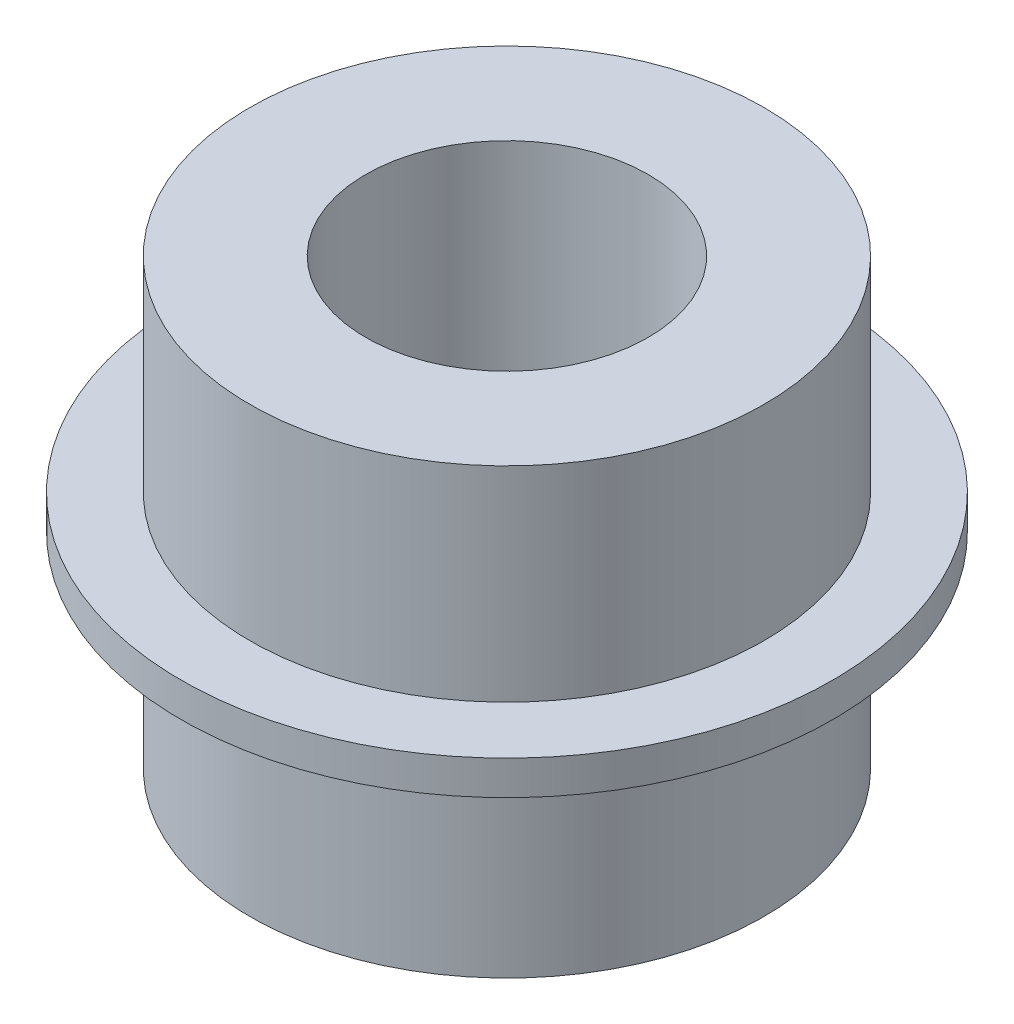
from build123d import *


with BuildPart() as part:
    # Sketch1 → Revolve1 (revolve)
    with BuildSketch(Plane.XY):
        Polygon((-4.125, -6.477), (-4.125, 6.477), (-7.51, 6.477), (-7.51, 0.5), (-9.51, 0.5), (-9.51, -0.5), (-7.51, -0.5), (-7.51, -6.477), align=None)
    revolve(axis=Axis((0, 0, 0), (0, 1, 0)))


solid = part.part
